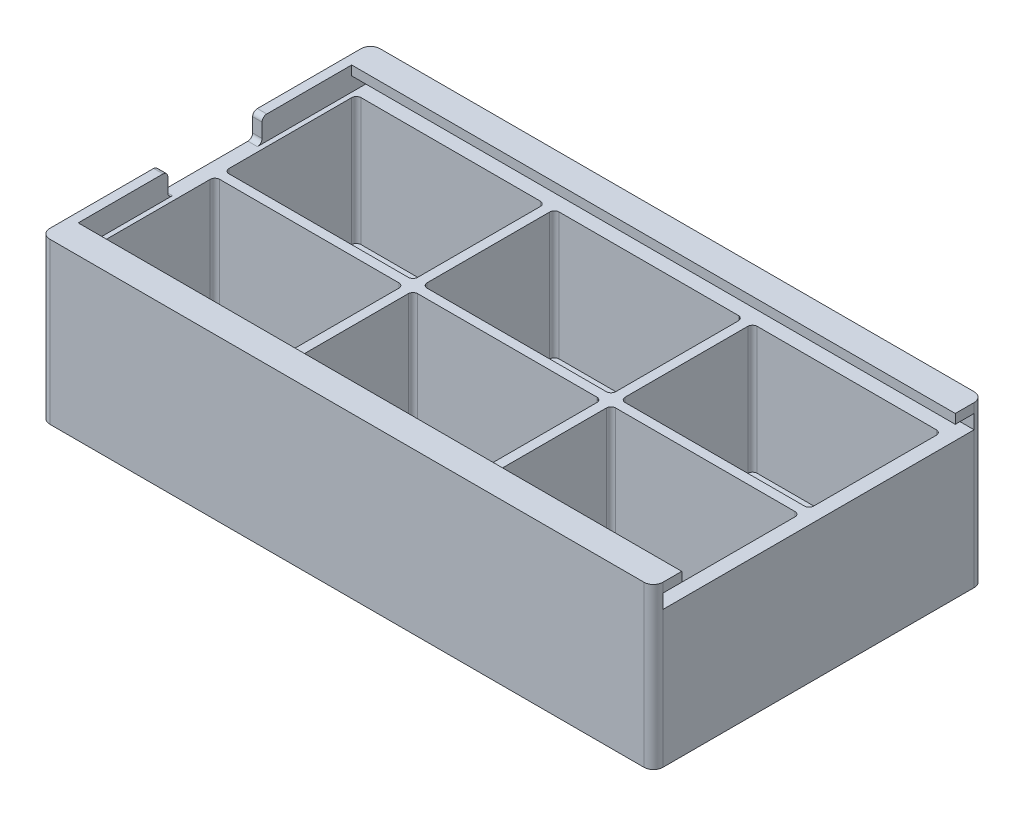
from build123d import *

# Parameters (mm, degrees)
SKETCH1_W           = 165.1
SKETCH1_H           = 88.9
BOSS_EXTRUDE1_DEPTH = 43.18
SKETCH2_W           = 50.8
SKETCH2_H           = 35.56
CUT_EXTRUDE1_DEPTH  = 40.64
CUT_EXTRUDE2_DEPTH  = 162.56
SKETCH4_W           = 2.54
SKETCH4_H           = 25.4
CUT_EXTRUDE3_DEPTH  = 6.35
FILLET1_START       = -1
FILLET1_DEPTH       = 45
FILLET2_R           = 1.27


with BuildPart() as part:
    # Sketch1 → Boss-Extrude1 (new body)
    with BuildSketch(Plane(origin=(0, 0, 0), x_dir=(1, 0, 0), z_dir=(0, 1, 0))):
        with Locations((82.55, 44.45)):
            Rectangle(SKETCH1_W, SKETCH1_H)
    extrude(amount=BOSS_EXTRUDE1_DEPTH)

    # Sketch2 → Cut-Extrude1 (cut)
    with BuildSketch(Plane(origin=(0, 43.18, 0), x_dir=(1, 0, 0), z_dir=(0, 1, 0))):
        with Locations((29.21, 63.5)):
            Rectangle(SKETCH2_W, SKETCH2_H)
        with Locations((29.21, 25.4)):
            Rectangle(SKETCH2_W, SKETCH2_H)
        with Locations((82.55, 63.5)):
            Rectangle(SKETCH2_W, SKETCH2_H)
        with Locations((135.89, 63.5)):
            Rectangle(SKETCH2_W, SKETCH2_H)
        with Locations((135.89, 25.4)):
            Rectangle(SKETCH2_W, SKETCH2_H)
        with Locations((82.55, 25.4)):
            Rectangle(SKETCH2_W, SKETCH2_H)
    extrude(amount=-CUT_EXTRUDE1_DEPTH, mode=Mode.SUBTRACT)

    # Sketch3 → Cut-Extrude2 (cut)
    with BuildSketch(Plane(origin=(165.1, 0, 0), x_dir=(0, 0, -1), z_dir=(1, 0, 0))):
        Polygon((2.54, 40.64), (7.62, 40.64), (7.62, 43.18), (81.28, 43.18), (81.28, 40.64), (86.36, 40.64), (86.36, 36.83), (2.54, 36.83), align=None)
    extrude(amount=-CUT_EXTRUDE2_DEPTH, mode=Mode.SUBTRACT)

    # Sketch4 → Cut-Extrude3 (cut)
    with BuildSketch(Plane(origin=(0, 43.18, 0), x_dir=(1, 0, 0), z_dir=(0, 1, 0))):
        with Locations((1.27, 44.45)):
            Rectangle(SKETCH4_W, SKETCH4_H)
    extrude(amount=-CUT_EXTRUDE3_DEPTH, mode=Mode.SUBTRACT)

    # Fillet1: read off the stored shape, not the designer's step
    # Fillet1 outline → Fillet1 (cut)
    with BuildSketch(Plane(origin=(0, 0, 0), x_dir=(1, 0, 0), z_dir=(0, 1, 0)).offset(FILLET1_START)):
        with BuildLine():
            Line((0, 88.9), (0, 86.36))
            ThreePointArc((0, 86.36), (0.743948776, 88.156051224), (2.54, 88.9))
            Line((2.54, 88.9), (0, 88.9))
        make_face()
        with BuildLine():
            ThreePointArc((2.54, 0), (0.743948776, 0.743948776), (0, 2.54))
            Line((0, 2.54), (0, 0))
            Line((0, 0), (2.54, 0))
        make_face()
        with BuildLine():
            Line((165.1, 88.9), (162.56, 88.9))
            ThreePointArc((162.56, 88.9), (164.356051224, 88.156051224), (165.1, 86.36))
            Line((165.1, 86.36), (165.1, 88.9))
        make_face()
        with BuildLine():
            ThreePointArc((165.1, 2.54), (164.356051224, 0.743948776), (162.56, 0))
            Line((162.56, 0), (165.1, 0))
            Line((165.1, 0), (165.1, 2.54))
        make_face()
    extrude(amount=FILLET1_DEPTH, mode=Mode.SUBTRACT)

    # Fillet2
    fillet2_edges = [part.edges().sort_by_distance(p)[0] for p in [
        (1.27, 36.83, -57.15),
        (1.27, 36.83, -31.75),
        (1.27, 43.18, -31.75),
        (1.27, 43.18, -57.15),
        (57.15, 19.685, -7.62),
        (57.15, 19.685, -43.18),
        (107.95, 19.685, -43.18),
        (107.95, 19.685, -7.62),
        (110.49, 19.685, -45.72),
        (110.49, 19.685, -81.28),
        (161.29, 19.685, -81.28),
        (161.29, 19.685, -45.72),
        (57.15, 19.685, -45.72),
        (57.15, 19.685, -81.28),
        (107.95, 19.685, -81.28),
        (107.95, 19.685, -45.72),
        (3.81, 19.685, -7.62),
        (3.81, 19.685, -43.18),
        (54.61, 19.685, -43.18),
        (54.61, 19.685, -7.62),
        (110.49, 19.685, -7.62),
        (110.49, 19.685, -43.18),
        (161.29, 19.685, -43.18),
        (161.29, 19.685, -7.62),
        (3.81, 19.685, -45.72),
        (3.81, 19.685, -81.28),
        (54.61, 19.685, -81.28),
        (54.61, 19.685, -45.72),
    ]]
    fillet(fillet2_edges, radius=FILLET2_R)


solid = part.part
